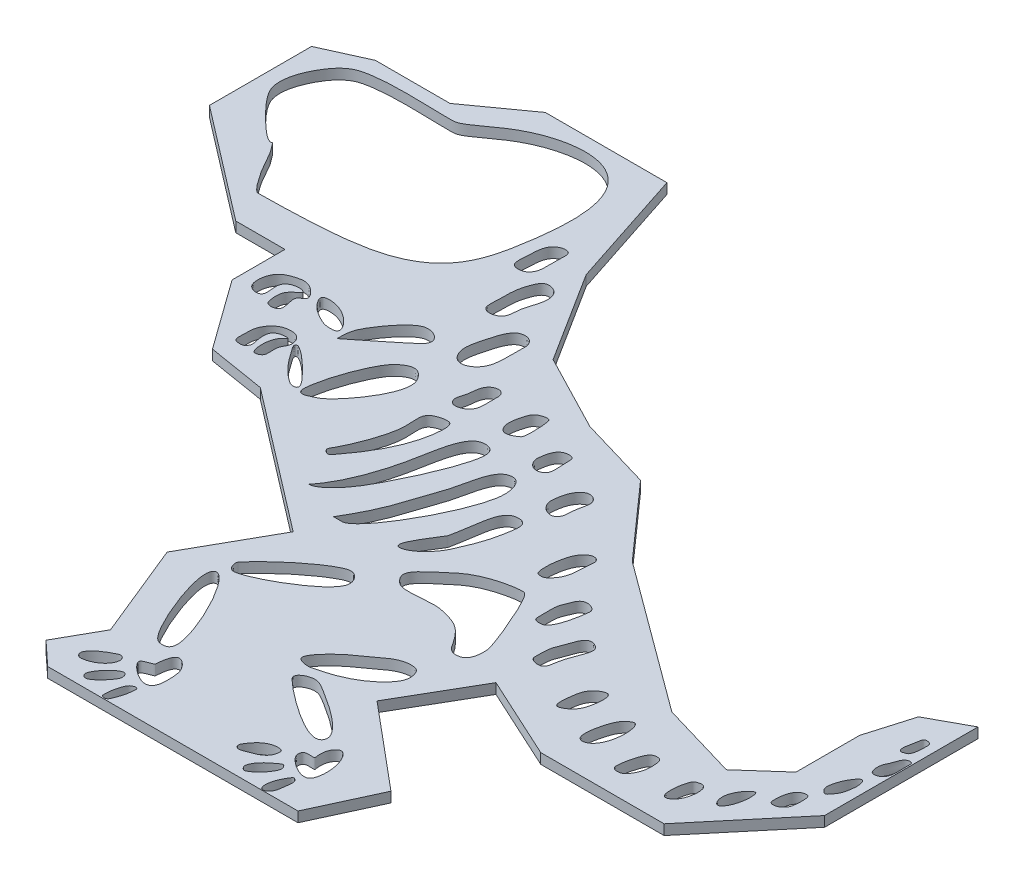
from build123d import *

# Parameters (mm, degrees)
BOSS_EXTRUDE1_DEPTH = 3.81
CUT_EXTRUDE2_DEPTH  = 224.140655074
CUT_EXTRUDE3_DEPTH  = 224.140655216
CUT_EXTRUDE4_DEPTH  = 224.140655216
CUT_EXTRUDE5_DEPTH  = 224.140655216
CUT_EXTRUDE6_DEPTH  = 224.140655216
CUT_EXTRUDE7_DEPTH  = 224.140655216
CUT_EXTRUDE8_DEPTH  = 224.140655216


with BuildPart() as part:
    # Sketch1 → Boss-Extrude1 (new body)
    with BuildSketch(Plane(origin=(0, 0, 0), x_dir=(1, 0, 0), z_dir=(0, 1, 0))):
        Polygon((-169.545, -133.35), (169.545, -133.35), (169.545, 133.35), (169.545, 138.62230863), (-174.81730863, 138.62230863), (-174.81730863, -133.35), align=None)
    extrude(amount=BOSS_EXTRUDE1_DEPTH)

    # Sketch3 → Cut-Extrude2 (cut, through all)
    # profile 1 of 43: a face of its own
    with BuildSketch(Plane(origin=(0, 0, 0), x_dir=(1, 0, 0), z_dir=(0, 1, 0))):
        with BuildLine():
            add(Edge.make_bspline(
                [(-91.542015137, 37.322586792), (-91.65391835, 37.219614613), (-92.324533852, 36.146463954), (-89.862618928, 33.26958076), (-88.397020408, 31.932246621), (-84.173488223, 29.166918066), (-80.500148871, 28.584411737), (-77.971892345, 28.576736995), (-77.500470157, 31.347814716), (-83.496356819, 37.776390769), (-90.724073696, 38.075248049), (-91.542015137, 37.322586792)],
                knots=[0, 0, 0, 0, 0.019939008, 0.179451075, 0.222926196, 0.411215099, 0.451326174, 0.583925878, 0.625876608, 0.854258507, 1, 1, 1, 1], degree=3))
        make_face()
    # profile 2 of 43: a face of its own
    with BuildSketch(Plane(origin=(0, 0, 0), x_dir=(1, 0, 0), z_dir=(0, 1, 0))):
        with BuildLine():
            add(Edge.make_bspline(
                [(-64.465605753, 97.049360345), (-64.928481215, 96.690967494), (-66.440993777, 95.031911487), (-66.815282803, 90.607274201), (-67.28383934, 84.457199381), (-65.528344237, 82.73119463), (-60.948383615, 82.850152494), (-59.773156229, 86.583595001), (-59.873229938, 90.276527545), (-59.677474439, 94.762438544), (-59.777732328, 98.368239523), (-62.727108786, 98.395434907), (-64.465605753, 97.049360345)],
                knots=[0, 0, 0, 0, 0.04219084, 0.15370728, 0.286877941, 0.316430135, 0.449229221, 0.62682008, 0.664290155, 0.806192211, 0.841536971, 1, 1, 1, 1], degree=3))
        make_face()
    # profile 3 of 43: a face of its own
    with BuildSketch(Plane(origin=(0, 0, 0), x_dir=(1, 0, 0), z_dir=(0, 1, 0))):
        with BuildLine():
            add(Edge.make_bspline(
                [(14.503008104, -40.123351811), (14.784918609, -40.408632474), (17.681416759, -43.050216888), (26.977765283, -40.475629658), (36.88783772, -42.795077294), (39.946429394, -44.146076589), (45.121333433, -50.759226507), (46.423695951, -54.222078387), (52.745494658, -52.610973212), (53.448683375, -47.206065657), (51.877457911, -41.203269932), (43.388632106, -20.868490404), (39.242700075, -19.987344993), (27.594806512, -22.481963104), (14.200074455, -33.855216622), (10.967115451, -36.545188591), (14.503008104, -40.123351811)],
                knots=[0, 0, 0, 0, 0.015837931, 0.142541383, 0.177931603, 0.334349907, 0.366262752, 0.465147213, 0.48406968, 0.53656496, 0.553468887, 0.636205025, 0.659820232, 0.766005755, 0.801351051, 1, 1, 1, 1], degree=3))
        make_face()
    # profile 4 of 43: a face of its own
    with BuildSketch(Plane(origin=(0, 0, 0), x_dir=(1, 0, 0), z_dir=(0, 1, 0))):
        with BuildLine():
            add(Edge.make_bspline(
                [(21.227935875, -83.730440807), (21.300473309, -83.791267604), (22.056313977, -84.275855241), (24.632048988, -84.927808514), (29.747397872, -83.57190053), (39.153458634, -81.185635396), (48.294927234, -71.776271451), (47.274908615, -67.058025129), (46.563599695, -65.125405624), (39.333905034, -64.728189349), (34.694670706, -69.426364932), (26.004696402, -74.957304988), (19.386944274, -82.18666381), (21.227935875, -83.730440807)],
                knots=[0, 0, 0, 0, 0.008450928, 0.076058351, 0.110192488, 0.341341371, 0.49116735, 0.514894615, 0.571534092, 0.596921116, 0.743377838, 0.785516435, 1, 1, 1, 1], degree=3))
        make_face()
    # profile 5 of 43: a face of its own
    with BuildSketch(Plane(origin=(0, 0, 0), x_dir=(1, 0, 0), z_dir=(0, 1, 0))):
        with BuildLine():
            add(Edge.make_bspline(
                [(0.528348946, 25.886998649), (0.505540723, 25.710982939), (0.282642067, 24.005189775), (2.570621522, 20.257693993), (6.987295331, 21.591947819), (7.654316072, 25.318925865), (7.250886278, 29.954541047), (7.168397685, 32.122361022), (5.397084842, 32.614817048), (1.223182713, 31.499890851), (0.808439781, 28.048516774), (0.528348946, 25.886998649)],
                knots=[0, 0, 0, 0, 0.02018473, 0.201847299, 0.395048739, 0.435785721, 0.589946966, 0.620753891, 0.713048045, 0.752126333, 1, 1, 1, 1], degree=3))
        make_face()
    # profile 6 of 43: a face of its own
    with BuildSketch(Plane(origin=(0, 0, 0), x_dir=(1, 0, 0), z_dir=(0, 1, 0))):
        with BuildLine():
            add(Edge.make_bspline(
                [(-16.11464107, 29.900272665), (-15.995954189, 29.474736773), (-14.458742174, 25.867545804), (-10.399312478, 28.553035005), (-8.800854843, 29.81754613), (-8.968295772, 38.356758859), (-10.089860529, 40.6949049), (-14.393975608, 39.512575362), (-16.032752546, 34.67183969), (-16.647643111, 31.811279982), (-16.11464107, 29.900272665)],
                knots=[0, 0, 0, 0, 0.042268334, 0.380415008, 0.444917025, 0.622786494, 0.659427082, 0.774682316, 0.810180298, 1, 1, 1, 1], degree=3))
        make_face()
    # profile 7 of 43: a face of its own
    with BuildSketch(Plane(origin=(0, 0, 0), x_dir=(1, 0, 0), z_dir=(0, 1, 0))):
        with BuildLine():
            add(Edge.make_bspline(
                [(-55.897078026, 29.560995971), (-56.281695729, 29.237623882), (-59.892930098, 25.914479253), (-65.348827094, 11.195615076), (-65.892012104, 1.164942712), (-60.702129369, 3.505018313), (-55.699629705, 6.12128485), (-43.745474106, 22.571691345), (-48.718728828, 30.677227321), (-51.981125662, 32.853381338), (-55.897078026, 29.560995971)],
                knots=[0, 0, 0, 0, 0.015507931, 0.139571378, 0.162470174, 0.221597091, 0.288545529, 0.765006118, 0.842107323, 1, 1, 1, 1], degree=3))
        make_face()
    # profile 8 of 43: a face of its own
    with BuildSketch(Plane(origin=(0, 0, 0), x_dir=(1, 0, 0), z_dir=(0, 1, 0))):
        with BuildLine():
            add(Edge.make_bspline(
                [(51.387862225, -114.803893869), (51.382454936, -115.02464443), (51.522810052, -117.252544512), (58.198852632, -121.947186087), (62.294303476, -120.427581674), (63.572660302, -111.464061725), (59.498243913, -104.591906984), (55.321691692, -107.737950785), (55.597026045, -112.859160613), (55.907390911, -113.110216387), (53.563388173, -113.040239128), (51.436528275, -112.817120514), (51.387862225, -114.803893869)],
                knots=[0, 0, 0, 0, 0.017018823, 0.153169411, 0.178134687, 0.249652763, 0.420161936, 0.462199194, 0.67002535, 0.813831713, 0.846829178, 1, 1, 1, 1], degree=3))
        make_face()
    # profile 9 of 43: a face of its own
    with BuildSketch(Plane(origin=(0, 0, 0), x_dir=(1, 0, 0), z_dir=(0, 1, 0))):
        with BuildLine():
            add(Edge.make_bspline(
                [(114.6867528, -59.924818057), (114.729491118, -60.095771327), (115.27666835, -61.237285574), (118.381294228, -61.137338592), (121.421165978, -56.578556254), (121.743281053, -53.534186394), (121.067717316, -48.792781014), (118.753618209, -48.588343635), (116.017751001, -50.429954218), (114.248187844, -58.170558233), (114.6867528, -59.924818057)],
                knots=[0, 0, 0, 0, 0.017057634, 0.153518708, 0.216852434, 0.587061175, 0.650554742, 0.788294535, 0.824960808, 1, 1, 1, 1], degree=3))
        make_face()
    # profile 10 of 43: a face of its own
    with BuildSketch(Plane(origin=(0, 0, 0), x_dir=(1, 0, 0), z_dir=(0, 1, 0))):
        with BuildLine():
            add(Edge.make_bspline(
                [(-4.062132727, -132.417419648), (-4.055925816, -132.460276796), (-3.995496856, -132.83788407), (-2.074927879, -133.311557533), (-0.468516826, -129.379969418), (0.1790829, -127.156761212), (0.38630734, -123.038001402), (-1.777009786, -123.942012355), (-3.322641715, -125.450791586), (-4.366161003, -130.318181466), (-4.062132727, -132.417419648)],
                knots=[0, 0, 0, 0, 0.009256087, 0.083304785, 0.118716357, 0.327960231, 0.368328179, 0.482027886, 0.546616315, 1, 1, 1, 1], degree=3))
        make_face()
    # profile 11 of 43: a face of its own
    with BuildSketch(Plane(origin=(0, 0, 0), x_dir=(1, 0, 0), z_dir=(0, 1, 0))):
        with BuildLine():
            add(Edge.make_bspline(
                [(37.896352596, -11.861878545), (38.021586866, -11.949542534), (39.285826174, -12.170741801), (40.555392075, -12.326721646), (44.832936323, -6.803541624), (44.308296583, -2.390571595), (45.200161781, 4.120933438), (41.900628824, 4.834576407), (37.043512324, -1.087301561), (36.557927918, -10.92498127), (37.896352596, -11.861878545)],
                knots=[0, 0, 0, 0, 0.020780416, 0.187023747, 0.240790841, 0.504684265, 0.55922741, 0.731679145, 0.777912051, 1, 1, 1, 1], degree=3))
        make_face()
    # profile 12 of 43: a face of its own
    with BuildSketch(Plane(origin=(0, 0, 0), x_dir=(1, 0, 0), z_dir=(0, 1, 0))):
        with BuildLine():
            add(Edge.make_bspline(
                [(163.492515477, 6.34287981), (163.324497697, 6.123428016), (162.947928924, 3.256530552), (161.889045776, 0.279355237), (162.840029989, -1.956108104), (163.815199152, -1.498796138), (166.092000241, -0.926971014), (166.292095404, 3.154359675), (166.273456546, 6.687158303), (163.980310696, 6.980000096), (163.492515477, 6.34287981)],
                knots=[0, 0, 0, 0, 0.03326737, 0.299406326, 0.353220498, 0.517594919, 0.573596104, 0.857231157, 0.903416985, 1, 1, 1, 1], degree=3))
        make_face()
    # profile 13 of 43: a face of its own
    with BuildSketch(Plane(origin=(0, 0, 0), x_dir=(1, 0, 0), z_dir=(0, 1, 0))):
        with BuildLine():
            add(Edge.make_bspline(
                [(149.250099333, -41.947484614), (149.112602169, -41.873290304), (147.486566068, -42.154554618), (143.082368883, -48.26832991), (146.687679051, -56.040891514), (150.475980161, -47.460631502), (149.678225908, -42.17850433), (149.250099333, -41.947484614)],
                knots=[0, 0, 0, 0, 0.035839077, 0.358390766, 0.518048392, 0.888407435, 1, 1, 1, 1], degree=3))
        make_face()
    # profile 14 of 43: a face of its own
    with BuildSketch(Plane(origin=(0, 0, 0), x_dir=(1, 0, 0), z_dir=(0, 1, 0))):
        with BuildLine():
            add(Edge.make_bspline(
                [(-79.98393803, 16.753249035), (-80.081010975, 16.804943504), (-80.930915658, 17.23682462), (-81.941957742, 16.697682781), (-75.814186935, 7.703624546), (-72.590575365, 5.316326099), (-69.38511458, 3.007902086), (-67.151603708, 2.99090111), (-67.061756876, 5.770904446), (-76.209431856, 14.74320294), (-79.98393803, 16.753249035)],
                knots=[0, 0, 0, 0, 0.004766014, 0.042894126, 0.109883005, 0.607665921, 0.682309035, 0.781671031, 0.814682152, 1, 1, 1, 1], degree=3))
        make_face()
    # profile 15 of 43: a face of its own
    with BuildSketch(Plane(origin=(0, 0, 0), x_dir=(1, 0, 0), z_dir=(0, 1, 0))):
        with BuildLine():
            add(Edge.make_bspline(
                [(16.803913905, 15.294425326), (16.754957699, 14.823466123), (16.449667367, 10.94963843), (21.405877953, 8.195306275), (24.735032391, 12.315189368), (23.361824106, 12.783664316), (25.658708788, 22.128843056), (22.160061855, 24.127497735), (17.744419103, 21.428220159), (17.043006767, 17.594501107), (16.803913905, 15.294425326)],
                knots=[0, 0, 0, 0, 0.035053188, 0.315478688, 0.385774496, 0.667715456, 0.713640808, 0.799102661, 0.828806853, 1, 1, 1, 1], degree=3))
        make_face()
    # profile 16 of 43: a face of its own
    with BuildSketch(Plane(origin=(0, 0, 0), x_dir=(1, 0, 0), z_dir=(0, 1, 0))):
        with BuildLine():
            add(Edge.make_bspline(
                [(-33.716806314, -25.510766217), (-33.795983845, -25.59262967), (-33.972322493, -25.693579689), (-30.748658466, -26.108813315), (-20.77783359, -13.179075112), (-9.203609991, 12.129244185), (-10.705794687, 20.064484295), (-17.509488953, 21.092286771), (-20.533417018, 13.203205411), (-25.419478303, -15.926894582), (-32.937275102, -24.704791132), (-33.716806314, -25.510766217)],
                knots=[0, 0, 0, 0, 0.029366847, 0.264301623, 0.315128072, 0.486804886, 0.514976536, 0.57538497, 0.668411345, 0.710872848, 1, 1, 1, 1], degree=3))
        make_face()
    # profile 17 of 43: a face of its own
    with BuildSketch(Plane(origin=(0, 0, 0), x_dir=(1, 0, 0), z_dir=(0, 1, 0))):
        with BuildLine():
            add(Edge.make_bspline(
                [(-75.656405604, 26.734733156), (-75.685258919, 26.581397222), (-76.17906958, 26.132819734), (-64.525462372, 35.502113407), (-54.693486016, 43.470265177), (-60.026962236, 47.369309442), (-66.638632959, 45.950973373), (-73.409271294, 36.388761793), (-75.825004315, 30.467137167), (-75.538425057, 27.361720295), (-75.656405604, 26.734733156)],
                knots=[0, 0, 0, 0, 0.035008556, 0.350085557, 0.465041353, 0.595637251, 0.633227651, 0.817865604, 0.856850814, 1, 1, 1, 1], degree=3))
        make_face()
    # profile 18 of 43: a face of its own
    with BuildSketch(Plane(origin=(0, 0, 0), x_dir=(1, 0, 0), z_dir=(0, 1, 0))):
        with BuildLine():
            add(Edge.make_bspline(
                [(155.096829505, -41.695622461), (155.207780619, -43.17127227), (157.821411323, -42.859237855), (159.996207355, -40.754596534), (160.656927203, -40.131757401), (160.662796845, -34.751027581), (160.543788755, -33.219867635), (154.911594471, -32.73358886), (154.983260895, -40.185159946), (155.096829505, -41.695622461)],
                knots=[0, 0, 0, 0, 0.323078917, 0.323078917, 0.615276181, 0.615276181, 0.669299186, 0.669299186, 1, 1, 1, 1], degree=3))
        make_face()
    # profile 19 of 43: a face of its own
    with BuildSketch(Plane(origin=(0, 0, 0), x_dir=(1, 0, 0), z_dir=(0, 1, 0))):
        with BuildLine():
            add(Edge.make_bspline(
                [(133.833634158, -60.416338349), (134.187174924, -60.482704728), (138.169435027, -59.201922768), (139.031280462, -51.605372257), (137.224017338, -49.091489431), (135.53091519, -49.355491983), (133.001548566, -50.565103145), (131.721307256, -60.019814098), (133.833634158, -60.416338349)],
                knots=[0, 0, 0, 0, 0.044939449, 0.404455044, 0.474621361, 0.676436303, 0.731496854, 1, 1, 1, 1], degree=3))
        make_face()
    # profile 20 of 43: a face of its own
    with BuildSketch(Plane(origin=(0, 0, 0), x_dir=(1, 0, 0), z_dir=(0, 1, 0))):
        with BuildLine():
            add(Edge.make_bspline(
                [(-56.542867789, 80.4090043), (-57.360025214, 78.432618613), (-58.194406257, 75.799332909), (-58.028803939, 68.474487513), (-58.986863676, 62.510504472), (-50.550479214, 63.678043941), (-51.45089827, 70.740916465), (-48.809310938, 75.846646023), (-48.957240293, 82.478753936), (-54.550262466, 84.612947751), (-55.936102592, 81.876533097), (-56.542867789, 80.4090043)],
                knots=[0, 0, 0, 0, 0.196712415, 0.227714318, 0.310019024, 0.419059956, 0.530055008, 0.660864195, 0.693252176, 0.853934819, 1, 1, 1, 1], degree=3))
        make_face()
    # profile 21 of 43: a face of its own
    with BuildSketch(Plane(origin=(0, 0, 0), x_dir=(1, 0, 0), z_dir=(0, 1, 0))):
        with BuildLine():
            add(Edge.make_bspline(
                [(-48.508391937, 45.499040123), (-48.379947717, 45.070892724), (-46.797809852, 41.31172592), (-43.023725639, 41.318782715), (-37.414567081, 46.012551944), (-38.007343737, 51.105896691), (-37.486169202, 62.913519191), (-43.281495409, 63.534466695), (-46.324042342, 58.818036159), (-47.064314202, 56.03746806), (-48.457455762, 50.709133163), (-49.153314986, 47.648783622), (-48.508391937, 45.499040123)],
                knots=[0, 0, 0, 0, 0.018862865, 0.169765788, 0.224468424, 0.511186589, 0.5669401, 0.726250019, 0.761023924, 0.87990525, 0.905288874, 1, 1, 1, 1], degree=3))
        make_face()
    # profile 22 of 43: a face of its own
    with BuildSketch(Plane(origin=(0, 0, 0), x_dir=(1, 0, 0), z_dir=(0, 1, 0))):
        with BuildLine():
            add(Edge.make_bspline(
                [(99.468289653, -57.571944512), (100.38729169, -57.988757795), (102.560142419, -57.361954265), (106.795538312, -51.009410446), (106.038905479, -40.492027762), (101.437501136, -43.466570073), (99.422569256, -46.306023928), (97.285986301, -56.582161044), (99.468289653, -57.571944512)],
                knots=[0, 0, 0, 0, 0.115048732, 0.164424759, 0.457167438, 0.517064259, 0.726800135, 1, 1, 1, 1], degree=3))
        make_face()
    # profile 23 of 43: a face of its own
    with BuildSketch(Plane(origin=(0, 0, 0), x_dir=(1, 0, 0), z_dir=(0, 1, 0))):
        with BuildLine():
            add(Edge.make_bspline(
                [(164.508977119, -13.721623532), (164.636894472, -13.84069279), (165.90747669, -14.489105315), (168.210257852, -13.267957268), (169.304803184, -9.944112583), (168.927783157, -6.494696115), (169.066671934, -2.793228643), (165.865254448, -3.115253922), (165.323141054, -6.655725913), (163.39839929, -10.171032453), (163.748447482, -13.013700037), (164.508977119, -13.721623532)],
                knots=[0, 0, 0, 0, 0.025273086, 0.227457777, 0.285534496, 0.547963553, 0.592733479, 0.700430126, 0.819782467, 0.849739455, 1, 1, 1, 1], degree=3))
        make_face()
    # profile 24 of 43: a face of its own
    with BuildSketch(Plane(origin=(0, 0, 0), x_dir=(1, 0, 0), z_dir=(0, 1, 0))):
        with BuildLine():
            add(Edge.make_bspline(
                [(160.661880967, -27.208216991), (160.679526674, -27.340861389), (160.903231282, -28.426409673), (162.615031879, -30.031500451), (164.498509592, -27.307766588), (165.696084114, -26.467349911), (166.315844112, -20.26097831), (165.308222188, -16.534954882), (161.360471491, -21.839701376), (160.482281831, -25.858153854), (160.661880967, -27.208216991)],
                knots=[0, 0, 0, 0, 0.019318757, 0.173868812, 0.232992094, 0.551428296, 0.601673612, 0.695640725, 0.803372461, 1, 1, 1, 1], degree=3))
        make_face()
    # profile 25 of 43: a face of its own
    with BuildSketch(Plane(origin=(0, 0, 0), x_dir=(1, 0, 0), z_dir=(0, 1, 0))):
        with BuildLine():
            add(Edge.make_bspline(
                [(-23.364075202, -71.605579889), (-23.694004458, -71.90397718), (-25.945628569, -76.754279406), (-14.824389788, -103.344156371), (-9.385384732, -105.166691161), (-6.182117533, -104.826126296), (-7.529771535, -92.024141264), (-20.125445229, -68.676471934), (-23.364075202, -71.605579889)],
                knots=[0, 0, 0, 0, 0.039948341, 0.359535068, 0.415964147, 0.547810052, 0.607861711, 1, 1, 1, 1], degree=3))
        make_face()
    # profile 26 of 43: a face of its own
    with BuildSketch(Plane(origin=(0, 0, 0), x_dir=(1, 0, 0), z_dir=(0, 1, 0))):
        with BuildLine():
            add(Edge.make_bspline(
                [(64.166924047, -39.25050065), (64.168506595, -39.396095037), (64.187957897, -40.885006937), (69.503167719, -42.172708808), (69.748225136, -38.199952527), (71.072778473, -31.805800156), (73.662890804, -27.536148012), (72.528725749, -24.612319278), (68.029972196, -22.438639865), (65.104519885, -32.751817814), (64.098261992, -32.933591609), (64.166924047, -39.25050065)],
                knots=[0, 0, 0, 0, 0.00740117, 0.074011699, 0.145377231, 0.175107865, 0.349516909, 0.381549495, 0.47363259, 0.67888517, 1, 1, 1, 1], degree=3))
        make_face()
    # profile 27 of 43: a face of its own
    with BuildSketch(Plane(origin=(0, 0, 0), x_dir=(1, 0, 0), z_dir=(0, 1, 0))):
        with BuildLine():
            add(Edge.make_bspline(
                [(83.62883511, -46.358616375), (83.408736561, -48.437118146), (83.095544077, -52.064796051), (88.758266548, -49.410311789), (90.752310321, -45.298539519), (91.195920449, -36.282309661), (84.532483456, -39.692868448), (84.00649782, -42.792156642), (83.62883511, -46.358616375)],
                knots=[0, 0, 0, 0, 0.14952472, 0.215411048, 0.467106659, 0.650036615, 0.743433515, 1, 1, 1, 1], degree=3))
        make_face()
    # profile 28 of 43: a face of its own
    with BuildSketch(Plane(origin=(0, 0, 0), x_dir=(1, 0, 0), z_dir=(0, 1, 0))):
        with BuildLine():
            add(Edge.make_bspline(
                [(25.497417042, -90.954494738), (25.664827867, -91.489087835), (30.552911299, -96.227292212), (48.486382242, -109.380433835), (54.725302478, -102.045838071), (39.539129351, -91.98322093), (30.012026201, -86.519823842), (24.955438972, -89.223795815), (25.497417042, -90.954494738)],
                knots=[0, 0, 0, 0, 0.038709293, 0.348383636, 0.434459415, 0.813391305, 0.874682012, 1, 1, 1, 1], degree=3))
        make_face()
    # profile 29 of 43: a face of its own
    with BuildSketch(Plane(origin=(0, 0, 0), x_dir=(1, 0, 0), z_dir=(0, 1, 0))):
        with BuildLine():
            add(Edge.make_bspline(
                [(4.051690369, -29.187445569), (4.379148576, -29.128001778), (7.870292683, -28.110765579), (12.468562593, -23.113351284), (16.629210697, -13.49025151), (18.176731192, -9.419349569), (19.940882766, 2.523261344), (15.198444153, 2.682902044), (10.757919011, -0.108618811), (10.645338166, -7.422098379), (8.258097358, -18.644881305), (9.97745686, -13.330416283), (0.932009995, -29.753764025), (4.051690369, -29.187445569)],
                knots=[0, 0, 0, 0, 0.008074965, 0.072674686, 0.099349961, 0.24815244, 0.27522562, 0.343008583, 0.384517974, 0.648810145, 0.705969015, 0.923070152, 1, 1, 1, 1], degree=3))
        make_face()
    # profile 30 of 43: a face of its own
    with BuildSketch(Plane(origin=(0, 0, 0), x_dir=(1, 0, 0), z_dir=(0, 1, 0))):
        with BuildLine():
            add(Edge.make_bspline(
                [(-14.331361336, -128.330665924), (-14.348704903, -128.459779145), (-14.402513724, -129.56547153), (-12.915760325, -130.361208959), (-9.85656431, -128.711061811), (-6.546091977, -124.729998531), (-6.115750506, -122.795474684), (-6.402967037, -121.387883004), (-8.703491355, -120.2501599), (-13.996507461, -125.837864856), (-14.331361336, -128.330665924)],
                knots=[0, 0, 0, 0, 0.015961604, 0.143654439, 0.194995899, 0.478034742, 0.527831783, 0.643169269, 0.691827809, 1, 1, 1, 1], degree=3))
        make_face()
    # profile 31 of 43: a face of its own
    with BuildSketch(Plane(origin=(0, 0, 0), x_dir=(1, 0, 0), z_dir=(0, 1, 0))):
        with BuildLine():
            add(Edge.make_bspline(
                [(-94.210826462, 34.03206876), (-93.778868206, 35.565427326), (-97.971608348, 39.889797899), (-105.04532316, 38.256139321), (-109.262624582, 36.339915398), (-110.014173652, 26.560828394), (-102.197140196, 25.93291178), (-105.239181187, 33.828881051), (-101.408424888, 35.947325289), (-98.038525023, 36.043633356), (-96.765829547, 35.429407157), (-97.223215311, 34.525777818), (-101.091935193, 32.411883608), (-100.879123663, 28.049951437), (-100.076511258, 24.388555366), (-93.782562734, 24.75578378), (-96.873371051, 29.781422296), (-96.158039742, 32.878034999), (-94.434404055, 33.238416566), (-94.210826462, 34.03206876)],
                knots=[0, 0, 0, 0, 0.094856815, 0.116602415, 0.217456002, 0.292256507, 0.349905874, 0.420597596, 0.490923361, 0.502433042, 0.531998702, 0.545686405, 0.635614364, 0.729475404, 0.747475955, 0.81561987, 0.932464978, 0.950902991, 1, 1, 1, 1], degree=3))
        make_face()
    # profile 32 of 43: a face of its own
    with BuildSketch(Plane(origin=(0, 0, 0), x_dir=(1, 0, 0), z_dir=(0, 1, 0))):
        with BuildLine():
            add(Edge.make_bspline(
                [(-32.296392677, 19.815291487), (-32.743265322, 19.611297579), (-36.049599472, 17.573556984), (-32.14109701, 11.124366865), (-39.587678183, -7.107494929), (-42.387618115, -11.275585907), (-39.793500224, -12.903958032), (-37.686612077, -9.871203555), (-27.514981128, 2.832637203), (-25.802626652, 19.536052323), (-28.375004488, 21.094564998), (-31.060179705, 20.379613152), (-32.296392677, 19.815291487)],
                knots=[0, 0, 0, 0, 0.025581572, 0.255815716, 0.500363414, 0.535000104, 0.594717894, 0.623341296, 0.813769401, 0.910608969, 0.929232029, 1, 1, 1, 1], degree=3))
        make_face()
    # profile 33 of 43: a face of its own
    with BuildSketch(Plane(origin=(0, 0, 0), x_dir=(1, 0, 0), z_dir=(0, 1, 0))):
        with BuildLine():
            add(Edge.make_bspline(
                [(-34.156804193, 28.821109473), (-34.096521909, 28.552216051), (-33.10153179, 25.785483769), (-26.335462911, 27.898336909), (-26.828655281, 34.685333217), (-26.297707828, 41.042372118), (-32.106437564, 40.446546104), (-33.133040078, 36.103895352), (-33.361864835, 31.919022497), (-34.501041184, 30.356603084), (-34.156804193, 28.821109473)],
                knots=[0, 0, 0, 0, 0.023977596, 0.239775963, 0.366940947, 0.500447341, 0.700245757, 0.833102498, 0.863077923, 1, 1, 1, 1], degree=3))
        make_face()
    # profile 34 of 43: a face of its own
    with BuildSketch(Plane(origin=(0, 0, 0), x_dir=(1, 0, 0), z_dir=(0, 1, 0))):
        with BuildLine():
            add(Edge.make_bspline(
                [(37.731420674, -121.996558791), (37.640202855, -122.154746655), (36.826967853, -123.614772993), (38.514858827, -124.757899796), (42.329418833, -123.130014526), (46.991296946, -122.172807504), (47.605359889, -116.752003995), (43.953987237, -116.128715108), (40.276714704, -117.582567879), (37.731420674, -121.996558791)],
                knots=[0, 0, 0, 0, 0.012393179, 0.111538615, 0.16164663, 0.501080148, 0.604295256, 0.654187241, 1, 1, 1, 1], degree=3))
        make_face()
    # profile 35 of 43: a face of its own
    with BuildSketch(Plane(origin=(0, 0, 0), x_dir=(1, 0, 0), z_dir=(0, 1, 0))):
        with BuildLine():
            add(Edge.make_bspline(
                [(45.262403398, -128.069825788), (45.235297006, -128.165666247), (45.011462115, -129.034746232), (46.1881916, -130.602872315), (48.942998782, -129.314572062), (51.948054537, -126.270149073), (53.458300274, -122.528744044), (52.315598044, -120.644263754), (48.619061476, -123.189465498), (45.984183052, -125.517819155), (45.262403398, -128.069825788)],
                knots=[0, 0, 0, 0, 0.014619941, 0.131579469, 0.176264738, 0.416787361, 0.458912449, 0.555390528, 0.610705259, 1, 1, 1, 1], degree=3))
        make_face()
    # profile 36 of 43: a face of its own
    with BuildSketch(Plane(origin=(0, 0, 0), x_dir=(1, 0, 0), z_dir=(0, 1, 0))):
        with BuildLine():
            add(Edge.make_bspline(
                [(-21.568989617, -63.743442059), (-21.660736115, -63.849561767), (-22.365187762, -64.678646665), (-21.551626997, -67.986190401), (-15.443103305, -67.98079859), (6.185601351, -55.93173735), (6.024944033, -48.258298832), (3.052508677, -44.763006251), (-10.004307568, -51.224699281), (-19.575391382, -61.437522292), (-21.568989617, -63.743442059)],
                knots=[0, 0, 0, 0, 0.014580203, 0.131221828, 0.185135605, 0.499804195, 0.55002184, 0.63709441, 0.683180633, 1, 1, 1, 1], degree=3))
        make_face()
    # profile 37 of 43: a face of its own
    with BuildSketch(Plane(origin=(0, 0, 0), x_dir=(1, 0, 0), z_dir=(0, 1, 0))):
        with BuildLine():
            add(Edge.make_bspline(
                [(-82.314922661, 16.753249035), (-82.383878665, 17.751158861), (-83.559677059, 20.896079441), (-88.30581655, 20.766636749), (-92.451412596, 18.628269782), (-94.475335864, 15.347042899), (-94.414040672, 10.390296426), (-94.806744403, 7.438220669), (-92.948660697, 6.821567639), (-90.978201797, 6.663028114), (-88.69498132, 9.382893521), (-90.7529198, 10.949057132), (-89.789435433, 17.576805895), (-82.628118517, 18.127069137), (-88.326221601, 16.02127275), (-87.864825992, 6.718148999), (-85.515175124, 6.579651856), (-83.862281231, 7.50213238), (-83.719520576, 10.319262502), (-84.214818349, 13.436026652), (-82.21100909, 15.249444172), (-82.314922661, 16.753249035)],
                knots=[0, 0, 0, 0, 0.047068315, 0.11231218, 0.130974699, 0.222280304, 0.240811144, 0.297752264, 0.310302931, 0.353767144, 0.375791751, 0.5085244, 0.532567077, 0.599626945, 0.665496137, 0.752070288, 0.767913803, 0.817707129, 0.834445184, 0.929070183, 1, 1, 1, 1], degree=3))
        make_face()
    # profile 38 of 43: a face of its own
    with BuildSketch(Plane(origin=(0, 0, 0), x_dir=(1, 0, 0), z_dir=(0, 1, 0))):
        with BuildLine():
            add(Edge.make_bspline(
                [(51.954326414, -26.214853249), (51.956569414, -26.354270045), (51.976510184, -27.633767537), (55.369981158, -27.705971171), (58.395839586, -24.73606195), (59.774457896, -16.723190922), (60.112992998, -12.920678418), (54.85256074, -10.974796738), (53.403889375, -14.953383971), (51.687853752, -19.160418705), (51.858549415, -20.261698297), (51.954326414, -26.214853249)],
                knots=[0, 0, 0, 0, 0.006884839, 0.061963551, 0.094777735, 0.302212496, 0.344797669, 0.494700117, 0.655484536, 0.706014524, 1, 1, 1, 1], degree=3))
        make_face()
    # profile 39 of 43: a face of its own
    with BuildSketch(Plane(origin=(0, 0, 0), x_dir=(1, 0, 0), z_dir=(0, 1, 0))):
        with BuildLine():
            add(Edge.make_bspline(
                [(0.28957124, -107.053757633), (-2.308691995, -104.884724033), (-4.299099327, -108.818200527), (-4.225536422, -112.45976951), (-4.399989959, -112.663544572), (-7.447735166, -113.725464194), (-9.438563979, -115.434714117), (-1.307245601, -122.152633545), (3.370438052, -119.363425445), (3.278488492, -114.698567828), (2.70652962, -109.541471075), (1.233741225, -107.84195199), (0.28957124, -107.053757633)],
                knots=[0, 0, 0, 0, 0.224541592, 0.449658485, 0.483563932, 0.554703602, 0.584878077, 0.755134209, 0.789708485, 0.896046568, 0.918404945, 1, 1, 1, 1], degree=3))
        make_face()
    # profile 40 of 43: a face of its own
    with BuildSketch(Plane(origin=(0, 0, 0), x_dir=(1, 0, 0), z_dir=(0, 1, 0))):
        with BuildLine():
            add(Edge.make_bspline(
                [(58.312887738, -123.422779511), (58.083347813, -123.455305247), (56.710105892, -125.242402943), (54.820065602, -129.226849343), (55.352246188, -132.735007236), (56.485014413, -133.368005938), (59.390378071, -131.546074626), (59.240451204, -128.95565236), (59.945853838, -124.279977972), (58.783226509, -123.356132653), (58.312887738, -123.422779511)],
                knots=[0, 0, 0, 0, 0.045548698, 0.409938285, 0.466513374, 0.5547245, 0.598805629, 0.863243531, 0.906668442, 1, 1, 1, 1], degree=3))
        make_face()
    # profile 41 of 43: a face of its own
    with BuildSketch(Plane(origin=(0, 0, 0), x_dir=(1, 0, 0), z_dir=(0, 1, 0))):
        with BuildLine():
            add(Edge.make_bspline(
                [(-21.847744238, -121.996558791), (-22.229639471, -122.967119181), (-21.53627492, -124.443974361), (-17.853217568, -124.488200499), (-12.520427048, -121.78179093), (-11.919408837, -116.922031449), (-13.406657796, -115.673292231), (-17.093180118, -117.471720549), (-20.294620736, -119.465457054), (-21.746772149, -121.739945193), (-21.847744238, -121.996558791)],
                knots=[0, 0, 0, 0, 0.126684623, 0.182310092, 0.51470529, 0.567134142, 0.654169757, 0.698544288, 0.966504921, 1, 1, 1, 1], degree=3))
        make_face()
    # profile 42 of 43: a face of its own
    with BuildSketch(Plane(origin=(0, 0, 0), x_dir=(1, 0, 0), z_dir=(0, 1, 0))):
        with BuildLine():
            Line((-18.663665482, -31.590942523), (-15.653411961, -31.590942523))
            add(Edge.make_bspline(
                [(-15.653411961, -31.590942523), (-10.285376125, -31.914622908), (6.578012984, -2.173647935), (5.850893328, 11.601493139), (3.72843688, 15.057604688), (-3.805047217, 14.041138452), (-4.488974589, 2.72896218), (-11.887709825, -17.025086616), (-10.88729594, -17.969812468), (-18.663665482, -31.590942523)],
                knots=[0, 0, 0, 0, 0.255506378, 0.293204724, 0.36767471, 0.400617206, 0.589687186, 0.65198884, 1, 1, 1, 1], degree=3))
        make_face()
    # profile 43 of 43: a face of its own
    with BuildSketch(Plane(origin=(0, 0, 0), x_dir=(1, 0, 0), z_dir=(0, 1, 0))):
        with BuildLine():
            Line((-119.144235873, 82.418218659), (-126.927391254, 73.630096189))
            Line((-126.927391254, 73.630096189), (-137.010115272, 81.884957958))
            Line((-137.010115272, 81.884957958), (-141.078582858, 71.625344046))
            Line((-141.078582858, 71.625344046), (-148.213141957, 74.278692471))
            add(Edge.make_bspline(
                [(-148.213141957, 74.278692471), (-143.487701839, 65.321841207), (-138.714650928, 58.943582801), (-136.373353199, 58.878397958), (-112.760951188, 59.332254084), (-91.362253532, 61.468029865), (-75.677999243, 73.237046333), (-70.613094317, 92.129618701), (-68.235387303, 123.523387208), (-86.380569194, 135.787581046), (-107.591163276, 131.24608797), (-120.992041717, 119.029571956), (-128.691399367, 118.165652673), (-148.463207606, 119.984560459), (-161.631910058, 116.44744683), (-167.461453696, 108.696394479), (-170.136693045, 99.81123495), (-167.60031958, 91.269354347), (-157.046995219, 81.178871001), (-153.265031965, 78.441970827), (-151.369249095, 77.523213613), (-150.925453681, 77.934416969)],
                knots=[0, 0, 0, 0, 0.018984348, 0.022838084, 0.038537356, 0.169302771, 0.266187522, 0.380411101, 0.502569533, 0.526558927, 0.620305042, 0.676480259, 0.697255758, 0.813526223, 0.832887641, 0.876336133, 0.925656276, 0.937589147, 0.989211991, 0.996098362, 1, 1, 1, 1], degree=3))
            Line((-150.925453681, 77.934416969), (-138.246921637, 90.392648083))
            Line((-138.246921637, 90.392648083), (-128.103478181, 81.884957958))
            Line((-128.103478181, 81.884957958), (-119.899842788, 89.623240357))
            Line((-119.899842788, 89.623240357), (-109.21215765, 83.225654668))
            add(Edge.make_bspline(
                [(-109.21215765, 83.225654668), (-97.916033864, 84.974493108), (-94.583753537, 101.704817267), (-94.420630711, 89.744668369), (-96.554857141, 79.669431837), (-110.889374104, 76.401371212)],
                knots=[0, 0, 0, 0, 0.274097447, 0.374097447, 1, 1, 1, 1], degree=3))
            Line((-110.889374104, 76.401371212), (-119.144235873, 82.418218659))
        make_face()
        with BuildLine():
            add(Edge.make_bspline(
                [(-117.024847802, 110.388110498), (-117.716419908, 109.192543284), (-115.903515897, 107.129919211), (-109.92584919, 107.475881667), (-111.527359297, 104.061440531), (-109.827516076, 101.822969562), (-103.023830852, 105.776755374), (-110.325563337, 115.737133194), (-116.294752446, 111.650275446), (-117.024847802, 110.388110498)],
                knots=[0, 0, 0, 0, 0.145822988, 0.342644759, 0.499469641, 0.526279666, 0.610745011, 0.846054106, 1, 1, 1, 1], degree=3))
        make_face(mode=Mode.SUBTRACT)
        with BuildLine():
            add(Edge.make_bspline(
                [(-103.812131332, 117.760811374), (-103.706341288, 117.454871245), (-102.573190929, 114.612577627), (-96.012516902, 116.622035782), (-95.789362747, 112.092983455), (-98.512049332, 108.506985763), (-98.154526442, 104.575036296), (-92.020559929, 103.476034211), (-81.586057452, 107.857952581), (-78.440052596, 116.376358471), (-80.854491553, 124.883799222), (-85.498566503, 127.927813624), (-94.354492862, 127.201880801), (-106.474304315, 125.459697882), (-103.812131332, 117.760811374)],
                knots=[0, 0, 0, 0, 0.007009998, 0.063089978, 0.075821331, 0.127313532, 0.164213847, 0.194635247, 0.431527533, 0.621159699, 0.65840646, 0.787818624, 0.82359563, 1, 1, 1, 1], degree=3))
        make_face(mode=Mode.SUBTRACT)
        with BuildLine():
            Line((-159.259731721, 106.444626113), (-159.674696805, 106.043598109))
            add(Edge.make_bspline(
                [(-159.674696805, 106.043598109), (-154.551671515, 105.997777946), (-151.031534908, 105.343403708), (-145.539374708, 103.675445116), (-142.275964132, 108.365125954), (-146.121613388, 113.754099074), (-155.153372973, 112.418726424), (-156.205063851, 109.796275581), (-159.259731721, 106.444626113)],
                knots=[0, 0, 0, 0, 0.249242272, 0.292414961, 0.431726888, 0.617682412, 0.674509723, 1, 1, 1, 1], degree=3))
        make_face(mode=Mode.SUBTRACT)
    extrude(amount=CUT_EXTRUDE2_DEPTH, mode=Mode.SUBTRACT)


with BuildPart() as cut_extrude2_piece_1:
    # of the separate pieces the step leaves, piece 1, a body of its own (cut_extrude2_pieces)
    add(part.part.solids().sort_by_distance((169.545, 0, 133.35))[0])


with BuildPart() as cut_extrude2_piece_2:
    # of the separate pieces the step leaves, piece 2, a body of its own (cut_extrude2_pieces)
    add(part.part.solids().sort_by_distance((-103.812131332, 0, -117.760811374))[0])


with BuildPart() as cut_extrude2_piece_3:
    # of the separate pieces the step leaves, piece 3, a body of its own (cut_extrude2_pieces)
    add(part.part.solids().sort_by_distance((-159.259731721, 0, -106.444626113))[0])


with BuildPart() as cut_extrude2_piece_4:
    # of the separate pieces the step leaves, piece 4, a body of its own (cut_extrude2_pieces)
    add(part.part.solids().sort_by_distance((-117.024847802, 0, -110.388110498))[0])


with BuildPart() as cut_extrude3_tool:
    # Sketch4 → Cut-Extrude3 (new, through all)
    with BuildSketch(Plane(origin=(0, 3.81, 0), x_dir=(1, 0, 0), z_dir=(0, 1, 0))):
        with BuildLine():
            Line((-150.925453681, 77.934416969), (-148.213141957, 74.278692471))
            add(Edge.make_bspline(
                [(-148.213141957, 74.278692471), (-143.487701839, 65.321841207), (-138.714650928, 58.943582801), (-136.373353199, 58.878397958), (-112.760951188, 59.332254084), (-91.362253532, 61.468029865), (-75.677999243, 73.237046333), (-70.613094317, 92.129618701), (-68.235387303, 123.523387208), (-86.380569194, 135.787581046), (-107.591163276, 131.24608797), (-120.992041717, 119.029571956), (-128.691399367, 118.165652673), (-148.463207606, 119.984560459), (-161.631910058, 116.44744683), (-167.461453696, 108.696394479), (-170.136693045, 99.81123495), (-167.60031958, 91.269354347), (-157.046995219, 81.178871001), (-153.265031965, 78.441970827), (-151.369249095, 77.523213613), (-150.925453681, 77.934416969)],
                knots=[0, 0, 0, 0, 0.018984348, 0.022838084, 0.038537356, 0.169302771, 0.266187522, 0.380411101, 0.502569533, 0.526558927, 0.620305042, 0.676480259, 0.697255758, 0.813526223, 0.832887641, 0.876336133, 0.925656276, 0.937589147, 0.989211991, 0.996098362, 1, 1, 1, 1], degree=3))
        make_face()
    extrude(amount=-CUT_EXTRUDE3_DEPTH)


with BuildPart() as cut_extrude2_piece_1_1:
    add(cut_extrude2_piece_1.part)

    # Cut-Extrude3: cut by cut_extrude3_tool
    add(cut_extrude3_tool.part, mode=Mode.SUBTRACT)

    # Sketch5 → Cut-Extrude4 (cut, through all)
    with BuildSketch(Plane(origin=(0, 3.81, 0), x_dir=(1, 0, 0), z_dir=(0, 1, 0))):
        Polygon((-181.71160937, 83.514527149), (-132.526474713, 45.759740687), (-114.168642763, 45.759740687), (-114.168642763, 26.016411987), (-95.464436626, 0), (-74.119643549, -3.490057323), (-21.365746615, -43.984245815), (-38.312695651, -74.085728266), (-23.764979766, -109.762269602), (-40.926303153, -140.244527716), (-191.756460814, -143.706939999), align=None)
    extrude(amount=-CUT_EXTRUDE4_DEPTH, mode=Mode.SUBTRACT)

    # Sketch6 → Cut-Extrude5 (cut, through all)
    with BuildSketch(Plane(origin=(0, 3.81, 0), x_dir=(1, 0, 0), z_dir=(0, 1, 0))):
        Polygon((-67.676968655, 148.490624798), (-49.809314372, 93.85683574), (-28.505572727, 60.183179591), (0, 45.408003934), (26.815433803, 37.505003001), (51.55526281, 9.672695368), (107.563486813, -31.560352977), (136.412699149, -40.062745804), (150.175718951, -27.828950425), (150.175718951, -4.07165408), (155.180267084, 12.909127059), (178.446451935, 25.583090113), (197.245366964, 183.882324627), align=None)
    extrude(amount=-CUT_EXTRUDE5_DEPTH, mode=Mode.SUBTRACT)

    # Sketch7 → Cut-Extrude6 (cut, through all)
    with BuildSketch(Plane(origin=(0, 3.81, 0), x_dir=(1, 0, 0), z_dir=(0, 1, 0))):
        Polygon((-195.499418526, 106.991556786), (-158.389675015, 123.75079579), (-130.557367382, 123.75079579), (-90.355145245, 152.613929632), (-195.499418526, 162.008263327), align=None)
    extrude(amount=-CUT_EXTRUDE6_DEPTH, mode=Mode.SUBTRACT)

    # Sketch8 → Cut-Extrude7 (cut, through all)
    with BuildSketch(Plane(origin=(0, 3.81, 0), x_dir=(1, 0, 0), z_dir=(0, 1, 0))):
        Polygon((179.746933853, -24.345526564), (142.265923805, -69.159777707), (96.229465812, -69.159777707), (65.266892294, -54.900697798), (48.970800969, -83.011455334), (60.655979662, -92.784513877), (80.748179053, -109.588898822), (65.266892294, -143.205407213), (201.726098089, -171.565250766), align=None)
    extrude(amount=-CUT_EXTRUDE7_DEPTH, mode=Mode.SUBTRACT)

    # Sketch9 → Cut-Extrude8 (cut, through all)
    with BuildSketch(Plane(origin=(0, 3.81, 0), x_dir=(1, 0, 0), z_dir=(0, 1, 0))):
        Polygon((-43.561326042, -114.849310785), (-7.370147833, -148.408403307), (-55.186371164, -144.460274775), align=None)
    extrude(amount=-CUT_EXTRUDE8_DEPTH, mode=Mode.SUBTRACT)


with BuildPart() as cut_extrude2_piece_2_1:
    add(cut_extrude2_piece_2.part)

    # Cut-Extrude3: cut by cut_extrude3_tool
    add(cut_extrude3_tool.part, mode=Mode.SUBTRACT)


with BuildPart() as cut_extrude2_piece_3_1:
    add(cut_extrude2_piece_3.part)

    # Cut-Extrude3: cut by cut_extrude3_tool
    add(cut_extrude3_tool.part, mode=Mode.SUBTRACT)


with BuildPart() as cut_extrude2_piece_4_1:
    add(cut_extrude2_piece_4.part)

    # Cut-Extrude3: cut by cut_extrude3_tool
    add(cut_extrude3_tool.part, mode=Mode.SUBTRACT)


solid = cut_extrude2_piece_1_1.part
